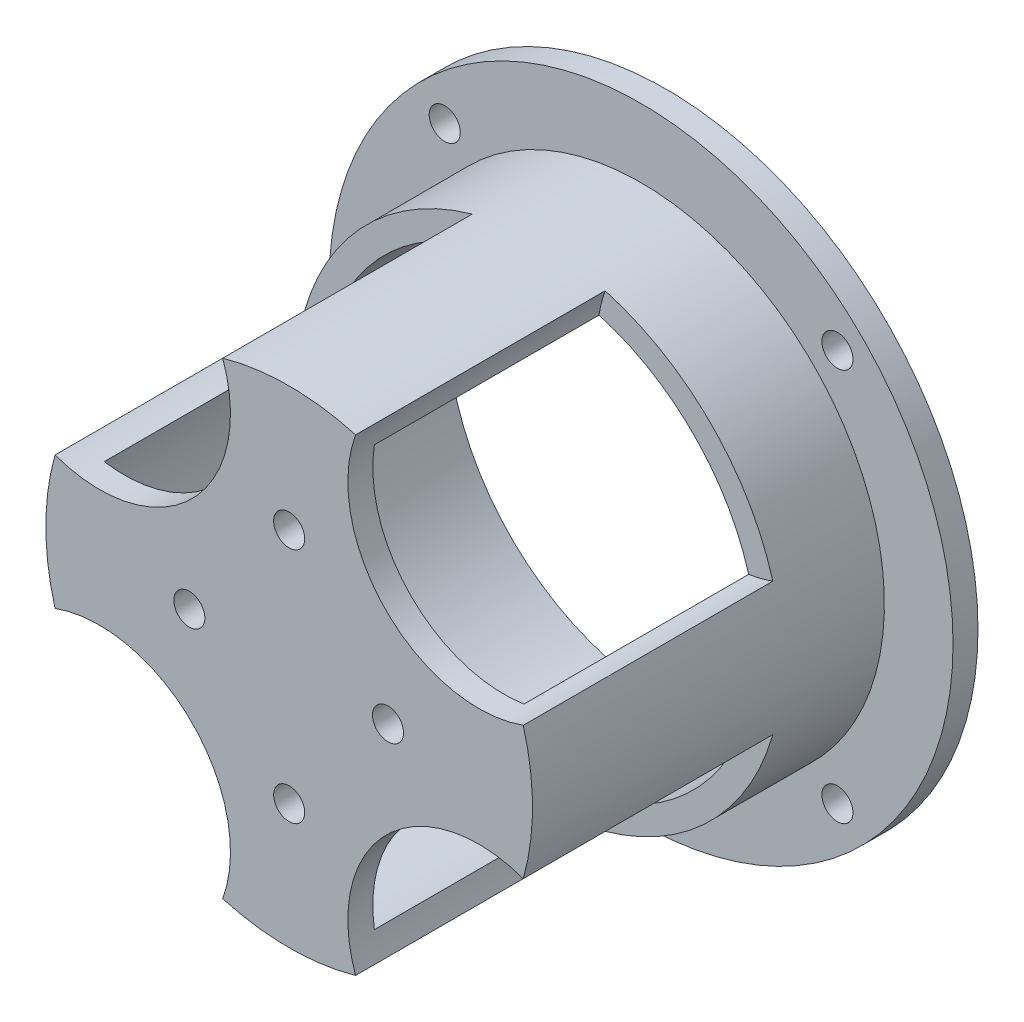
from build123d import *

# Parameters (mm, degrees)
SKETCH_3_R          = 0.6225
SKETCH_3_R_2        = 5.25
CUT_EXTRUDE_1_DEPTH = 10
EXTRUDE_START       = -1
SKETCH_4_R          = 12.5
SKETCH_4_R_2        = 8.75
EXTRUDE_1_DEPTH     = 1
SKETCH_9_R          = 0.6225
CUT_EXTRUDE_2_DEPTH = 23.612164868


with BuildPart() as part:
    # Эскиз1 → Повернуть1 (revolve)
    with BuildSketch(Plane(origin=(0, 0, 0), x_dir=(1, 0, 0), z_dir=(0, 1, 0))):
        Polygon((8.75, 1), (0, 1), (0, 0), (9.75, 0), (9.75, 15.1), (8.75, 15.1), align=None)
    revolve(axis=Axis((0, 0, 0), (0, 0, -1)))

    # Эскиз3 → Вырез-Вытянуть1 (cut)
    with BuildSketch(Plane.XY):
        with Locations((-4, 0)):
            Circle(SKETCH_3_R)
        with Locations((0, -4.75)):
            Circle(SKETCH_3_R)
        with Locations((3.96157844, 0)):
            Circle(SKETCH_3_R)
        with Locations((0, 4.75)):
            Circle(SKETCH_3_R)
        with Locations((7.601397898, -7.601397898)):
            Circle(SKETCH_3_R_2)
        with Locations((-7.601397898, -7.601397898)):
            Circle(SKETCH_3_R_2)
        with Locations((-7.601397898, 7.601397898)):
            Circle(SKETCH_3_R_2)
        with Locations((7.601397898, 7.601397898)):
            Circle(SKETCH_3_R_2)
    extrude(amount=-CUT_EXTRUDE_1_DEPTH, mode=Mode.SUBTRACT)

    # Эскиз4 → Бобышка-Вытянуть1 (add)
    with BuildSketch(Plane(origin=(0, 0, -15.1), x_dir=(-1, 0, 0), z_dir=(0, 0, -1)).offset(EXTRUDE_START)):
        Circle(SKETCH_4_R)
        Circle(SKETCH_4_R_2, mode=Mode.SUBTRACT)
    extrude(amount=EXTRUDE_1_DEPTH)

    # Эскиз9 → Вырез-Вытянуть2 (cut, through all)
    with BuildSketch(Plane.XY.offset(-14.1)):
        with Locations((7.866562941, 7.866562941)):
            Circle(SKETCH_9_R)
        with Locations((7.866562941, -7.866562941)):
            Circle(SKETCH_9_R)
        with Locations((-7.866562941, -7.866562941)):
            Circle(SKETCH_9_R)
        with Locations((-7.866562941, 7.866562941)):
            Circle(SKETCH_9_R)
    extrude(amount=-CUT_EXTRUDE_2_DEPTH, mode=Mode.SUBTRACT)


solid = part.part
